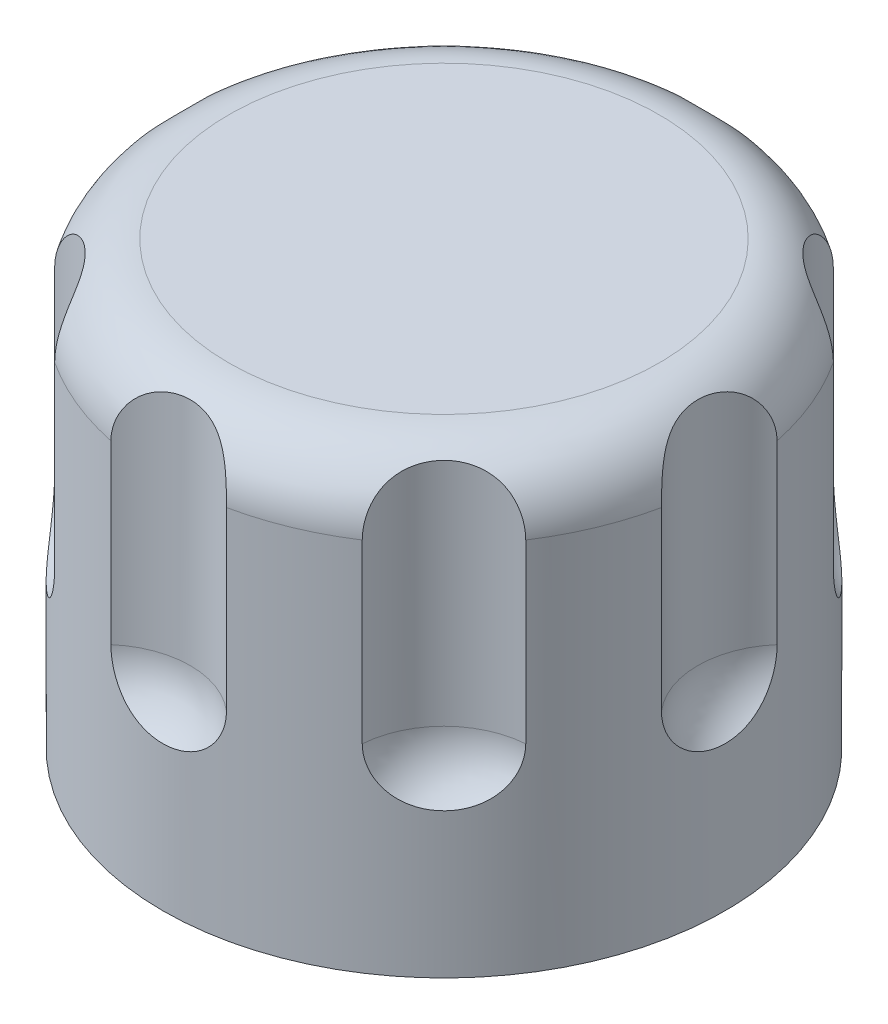
from build123d import *

# Parameters (mm, degrees)
SKETCH1_R               = 12.75
BOSS_EXTRUDE1_DEPTH     = 20
CUT_EXTRUDE1_DEPTH      = 27.928145127
CUT_EXTRUDE1_DEPTH_BACK = 18.3
SKETCH2_R               = 3.05
SKETCH3_R               = 3.5
CUT_EXTRUDE2_DEPTH      = 6
FILLET1_R               = 3
SKETCH5_R               = 4
CUT_EXTRUDE3_DEPTH      = 14
FILLET3_R               = 3


with BuildPart() as part:
    # Sketch1 → Boss-Extrude1 (new body)
    with BuildSketch(Plane(origin=(0, 0, 0), x_dir=(1, 0, 0), z_dir=(0, 1, 0))):
        with Locations(Location((0, 0, 0), (0, 0, 270))):
            Circle(SKETCH1_R)
    extrude(amount=BOSS_EXTRUDE1_DEPTH)

    # Sketch2 → Cut-Extrude1 (cut, two sides: drawn at the far end of the back side and taken through both)
    with BuildSketch(Plane.XZ.offset(-CUT_EXTRUDE1_DEPTH_BACK)):
        with Locations(Location((0, 0, 0), (0, 0, 90))):
            Circle(SKETCH2_R)
    extrude(amount=CUT_EXTRUDE1_DEPTH + CUT_EXTRUDE1_DEPTH_BACK, mode=Mode.SUBTRACT)

    # Sketch3 → Cut-Extrude2 (cut)
    with BuildSketch(Plane.XZ):
        with Locations(Location((0, 0, 0), (0, 0, 270))):
            Circle(SKETCH3_R)
    extrude(amount=-CUT_EXTRUDE2_DEPTH, mode=Mode.SUBTRACT)

    # Fillet1
    fillet1_edges = [part.edges().sort_by_distance(p)[0] for p in [
        (0, 20, -12.75),
    ]]
    fillet(fillet1_edges, radius=FILLET1_R)

    # Sketch5 → Cut-Extrude3 (cut)
    with BuildSketch(Plane(origin=(0, 20, 0), x_dir=(1, 0, 0), z_dir=(0, 1, 0))):
        with Locations((0, 15.5)):
            Circle(SKETCH5_R)
        with Locations((10.960155108, 10.960155108)):
            Circle(SKETCH5_R)
        with Locations((15.5, 0)):
            Circle(SKETCH5_R)
        with Locations((10.960155108, -10.960155108)):
            Circle(SKETCH5_R)
        with Locations((0, -15.5)):
            Circle(SKETCH5_R)
        with Locations((-10.960155108, -10.960155108)):
            Circle(SKETCH5_R)
        with Locations((-15.5, 0)):
            Circle(SKETCH5_R)
        with Locations((-10.960155108, 10.960155108)):
            Circle(SKETCH5_R)
    extrude(amount=-CUT_EXTRUDE3_DEPTH, mode=Mode.SUBTRACT)

    # Fillet3
    # the kernel refuses this fillet: 3 mm, written as the material it adds along each edge
    with BuildSketch(Plane(origin=(0, 6, 15.5), x_dir=(0.5240999982324142, 0, 0.8516567335803691), z_dir=(-0.8516567335803691, 0, 0.5240999982324142))) as fillet3_piece_1_section:
        with BuildLine():
            CenterArc((4 - FILLET3_R, FILLET3_R), FILLET3_R, 270, 90)
            Line((4 - FILLET3_R, 0), (4, 0))
            Line((4, 0), (4, FILLET3_R))
        make_face()
    fillet3_piece_1 = revolve(axis=Axis((0, 6, 15.5), (0, 1, 0)), revolution_arc=296.784649365, mode=Mode.PRIVATE)
    fillet3_piece_1 = fillet3_piece_1 & Plane(origin=(0, 6.906503108, 0), x_dir=(0, 0, 1), z_dir=(0, -1, 0)) * Cylinder(12.75, 17, mode=Mode.PRIVATE)
    add(fillet3_piece_1)
    with BuildSketch(Plane(origin=(-10.960155108, 6, 10.960155108), x_dir=(-0.2316175887878651, 0, 0.9728069143278617), z_dir=(-0.9728069143278617, 0, -0.2316175887878651))) as fillet3_piece_2_section:
        with BuildLine():
            CenterArc((4 - FILLET3_R, FILLET3_R), FILLET3_R, 270, 90)
            Line((4, FILLET3_R), (4, 0))
            Line((4, 0), (4 - FILLET3_R, 0))
        make_face()
    fillet3_piece_2 = revolve(axis=Axis((-10.960155108, 6, 10.960155108), (0, 1, 0)), revolution_arc=296.784649365, mode=Mode.PRIVATE)
    fillet3_piece_2 = fillet3_piece_2 & Plane(origin=(0, 6.906501973, 0), x_dir=(0, 0, 1), z_dir=(0, -1, 0)) * Cylinder(12.75, 16, mode=Mode.PRIVATE)
    add(fillet3_piece_2)
    with BuildSketch(Plane(origin=(-15.5, 6, 0), x_dir=(-0.8516567335803689, 0, -0.524099998232414), z_dir=(-0.524099998232414, 0, 0.8516567335803689))) as fillet3_piece_3_section:
        with BuildLine():
            CenterArc((4 - FILLET3_R, -FILLET3_R), FILLET3_R, 0, 90)
            Line((4, -FILLET3_R), (4, 0))
            Line((4, 0), (4 - FILLET3_R, 0))
        make_face()
    fillet3_piece_3 = revolve(axis=Axis((-15.5, 6, 0), (0, -1, 0)), revolution_arc=296.784649365, mode=Mode.PRIVATE)
    fillet3_piece_3 = fillet3_piece_3 & Plane(origin=(0, 6.90650195, 0), x_dir=(0, 0, 1), z_dir=(0, -1, 0)) * Cylinder(12.75, 16, mode=Mode.PRIVATE)
    add(fillet3_piece_3)
    with BuildSketch(Plane(origin=(-10.960155108, 6, -10.960155108), x_dir=(-0.9728069143278615, 0, -0.23161758878786548), z_dir=(0.23161758878786548, 0, -0.9728069143278615))) as fillet3_piece_4_section:
        with BuildLine():
            CenterArc((4 - FILLET3_R, FILLET3_R), FILLET3_R, 270, 90)
            Line((4, FILLET3_R), (4, 0))
            Line((4, 0), (4 - FILLET3_R, 0))
        make_face()
    fillet3_piece_4 = revolve(axis=Axis((-10.960155108, 6, -10.960155108), (0, 1, 0)), revolution_arc=296.784649365, mode=Mode.PRIVATE)
    fillet3_piece_4 = fillet3_piece_4 & Plane(origin=(0, 6.906501973, 0), x_dir=(0, 0, 1), z_dir=(0, -1, 0)) * Cylinder(12.75, 17, mode=Mode.PRIVATE)
    add(fillet3_piece_4)
    with BuildSketch(Plane(origin=(0, 6, -15.5), x_dir=(-0.5240999982324135, 0, -0.8516567335803694), z_dir=(0.8516567335803694, 0, -0.5240999982324135))) as fillet3_piece_5_section:
        with BuildLine():
            CenterArc((4 - FILLET3_R, FILLET3_R), FILLET3_R, 270, 90)
            Line((4, FILLET3_R), (4, 0))
            Line((4, 0), (4 - FILLET3_R, 0))
        make_face()
    fillet3_piece_5 = revolve(axis=Axis((0, 6, -15.5), (0, 1, 0)), revolution_arc=296.784649365, mode=Mode.PRIVATE)
    fillet3_piece_5 = fillet3_piece_5 & Plane(origin=(0, 6.906501973, 0), x_dir=(0, 0, 1), z_dir=(0, -1, 0)) * Cylinder(12.75, 16, mode=Mode.PRIVATE)
    add(fillet3_piece_5)
    with BuildSketch(Plane(origin=(10.960155108, 6, -10.960155108), x_dir=(0.2316175887878651, 0, -0.9728069143278617), z_dir=(0.9728069143278617, 0, 0.2316175887878651))) as fillet3_piece_6_section:
        with BuildLine():
            CenterArc((4 - FILLET3_R, FILLET3_R), FILLET3_R, 270, 90)
            Line((4, FILLET3_R), (4, 0))
            Line((4, 0), (4 - FILLET3_R, 0))
        make_face()
    fillet3_piece_6 = revolve(axis=Axis((10.960155108, 6, -10.960155108), (0, 1, 0)), revolution_arc=296.784649365, mode=Mode.PRIVATE)
    fillet3_piece_6 = fillet3_piece_6 & Plane(origin=(0, 6.906501973, 0), x_dir=(0, 0, 1), z_dir=(0, -1, 0)) * Cylinder(12.75, 16, mode=Mode.PRIVATE)
    add(fillet3_piece_6)
    with BuildSketch(Plane(origin=(15.5, 6, 0), x_dir=(0.8516567335803694, 0, -0.5240999982324135), z_dir=(0.5240999982324135, 0, 0.8516567335803694))) as fillet3_piece_7_section:
        with BuildLine():
            CenterArc((4 - FILLET3_R, FILLET3_R), FILLET3_R, 270, 90)
            Line((4, FILLET3_R), (4, 0))
            Line((4, 0), (4 - FILLET3_R, 0))
        make_face()
    fillet3_piece_7 = revolve(axis=Axis((15.5, 6, 0), (0, 1, 0)), revolution_arc=296.784649365, mode=Mode.PRIVATE)
    fillet3_piece_7 = fillet3_piece_7 & Plane(origin=(0, 6.906501973, 0), x_dir=(0, 0, 1), z_dir=(0, -1, 0)) * Cylinder(12.75, 17, mode=Mode.PRIVATE)
    add(fillet3_piece_7)
    with BuildSketch(Plane(origin=(10.960155108, 6, 10.960155108), x_dir=(0.9728069143278617, 0, 0.2316175887878651), z_dir=(-0.2316175887878651, 0, 0.9728069143278617))) as fillet3_piece_8_section:
        with BuildLine():
            CenterArc((4 - FILLET3_R, FILLET3_R), FILLET3_R, 270, 90)
            Line((4, FILLET3_R), (4, 0))
            Line((4, 0), (4 - FILLET3_R, 0))
        make_face()
    fillet3_piece_8 = revolve(axis=Axis((10.960155108, 6, 10.960155108), (0, 1, 0)), revolution_arc=296.784649365, mode=Mode.PRIVATE)
    fillet3_piece_8 = fillet3_piece_8 & Plane(origin=(0, 6.906501973, 0), x_dir=(0, 0, 1), z_dir=(0, -1, 0)) * Cylinder(12.75, 16, mode=Mode.PRIVATE)
    add(fillet3_piece_8)


solid = part.part
